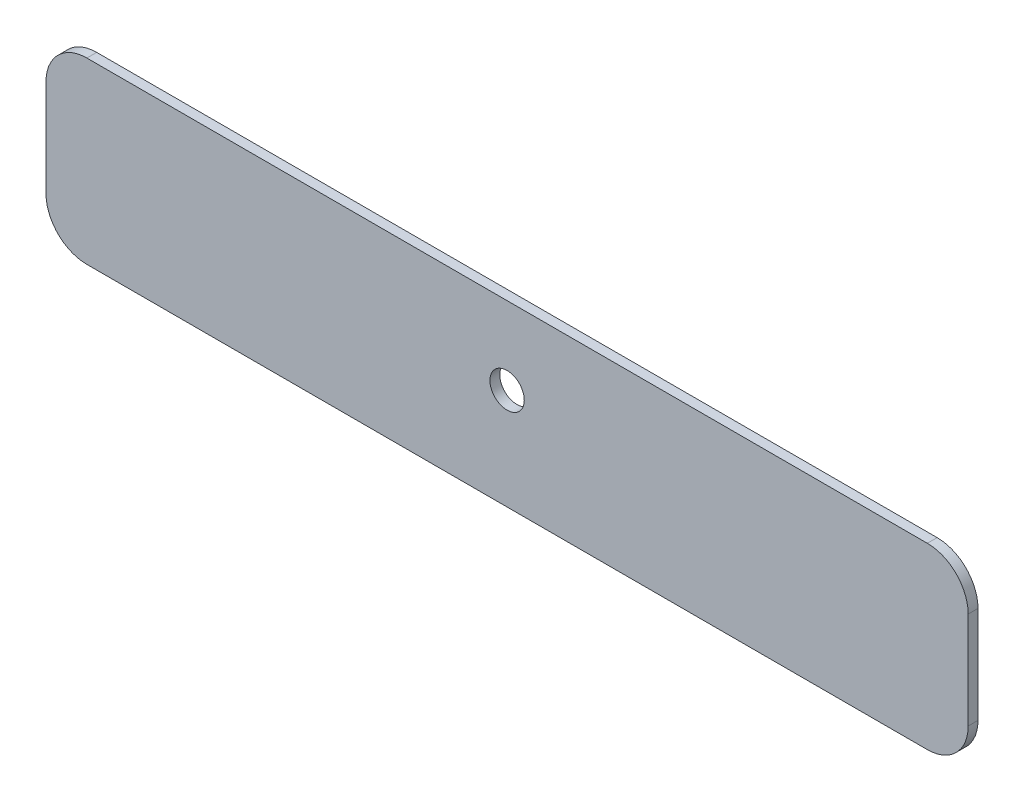
from build123d import *

# Parameters (mm, degrees)
SKETCH1_R           = 2.1
BOSS_EXTRUDE1_DEPTH = 1.2
FILLET1_R           = 5


with BuildPart() as part:
    # Sketch1 → Boss-Extrude1 (new body)
    with BuildSketch(Plane.XY):
        Polygon((-56.4, 136.5), (-56.4, 114.638335016), (56.4, 114.638335016), (56.4, 136.5), (0, 136.5), align=None)
        with Locations((0, 127)):
            Circle(SKETCH1_R, mode=Mode.SUBTRACT)
    extrude(amount=BOSS_EXTRUDE1_DEPTH)

    # Fillet1
    fillet1_edges = [part.edges().sort_by_distance(p)[0] for p in [
        (56.4, 114.638335016, 0.6),
        (-56.4, 114.638335016, 0.6),
        (56.4, 136.5, 0.6),
        (-56.4, 136.5, 0.6),
    ]]
    fillet(fillet1_edges, radius=FILLET1_R)


solid = part.part
